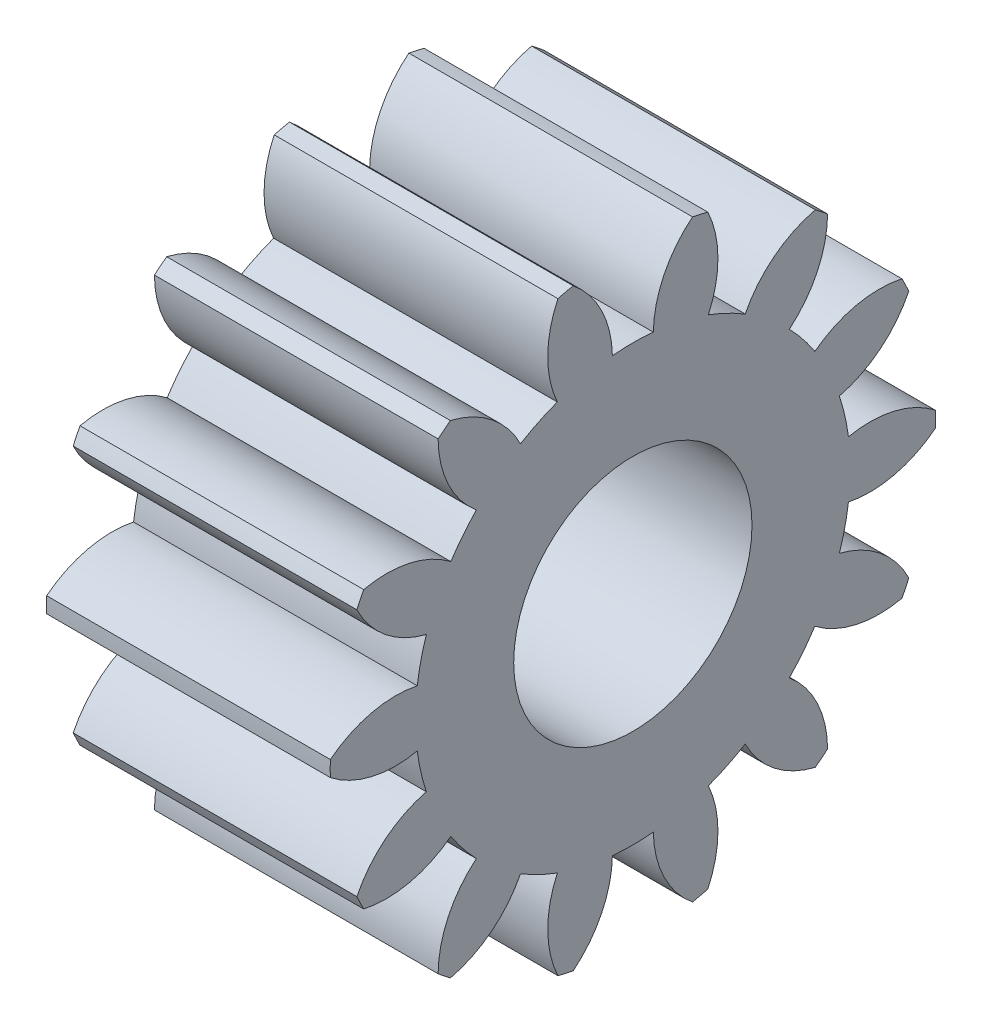
from build123d import *

# Parameters (mm, degrees)
BOSS_EXTRUDE1_START       = -4.9
BOSS_EXTRUDE1_DEPTH       = 4.9
BOSS_EXTRUDE1_START_2     = -8
BOSS_EXTRUDE1_2_OUTLINE_R = 5
BOSS_EXTRUDE1_2_DEPTH     = 3.1
SKETCH2_R                 = 5.05
CUT_EXTRUDE1_DEPTH        = 3.1
SKETCH3_R                 = 3.25
CUT_EXTRUDE2_DEPTH        = 13.227872143
SKETCH4_R                 = 4
CUT_EXTRUDE3_DEPTH        = 10
SKETCH5_R                 = 4
SKETCH5_R_2               = 3
BOSS_EXTRUDE2_DEPTH       = 4.9
BOSS_EXTRUDE3_DEPTH       = 1
BOSS_EXTRUDE3_DEPTH_BACK  = 1
FILLET1_R                 = 1
SKETCH8_R                 = 3.15
CUT_EXTRUDE4_DEPTH        = 10
BOSS_EXTRUDE4_START       = 3.1
SKETCH9_R                 = 5.05
SKETCH9_R_2               = 3.15
BOSS_EXTRUDE4_DEPTH       = 3.1
SKETCH10_R                = 9.67908905
CUT_EXTRUDE5_DEPTH        = 0.5


with BuildPart() as part:
    # Boss-Extrude1: read off the stored shape, not the designer's step
    # Boss-Extrude1 outline → Boss-Extrude1 (new body)
    with BuildSketch(Plane(origin=(8, 0, 0), x_dir=(0, 0, -1), z_dir=(1, 0, 0)).offset(BOSS_EXTRUDE1_START)):
        with BuildLine():
            ThreePointArc((-7.295176575, -3.283351754), (-7.207750943, -3.471069913), (-7.115495966, -3.656462382))
            ThreePointArc((-7.115495966, -3.656462382), (-5.907248739, -3.655787226), (-4.811777955, -3.146075955))
            ThreePointArc((-4.811777955, -3.146075955), (-4.494749193, -3.584442871), (-4.137918587, -3.991068875))
            ThreePointArc((-4.137918587, -3.991068875), (-4.878615514, -4.945652492), (-5.148134044, -6.123456202))
            ThreePointArc((-5.148134044, -6.123456202), (-4.987918415, -6.25465186), (-4.824360775, -6.381656769))
            ThreePointArc((-4.824360775, -6.381656769), (-3.736060578, -5.856809649), (-2.970230937, -4.922268702))
            ThreePointArc((-2.970230937, -4.922268702), (-2.494397616, -5.179670022), (-1.996475938, -5.391204395))
            ThreePointArc((-1.996475938, -5.391204395), (-2.249642501, -6.572630868), (-1.981440428, -7.750735051))
            ThreePointArc((-1.981440428, -7.750735051), (-1.780167471, -7.799423297), (-1.577701765, -7.842885766))
            ThreePointArc((-1.577701765, -7.842885766), (-0.824899799, -6.897819092), (-0.540393256, -5.723545765))
            ThreePointArc((-0.540393256, -5.723545765), (0, -5.749), (0.540393256, -5.723545765))
            ThreePointArc((0.540393256, -5.723545765), (0.824899799, -6.897819092), (1.577701765, -7.842885766))
            ThreePointArc((1.577701765, -7.842885766), (1.780167471, -7.799423297), (1.981440428, -7.750735051))
            ThreePointArc((1.981440428, -7.750735051), (2.249642501, -6.572630868), (1.996475938, -5.391204395))
            ThreePointArc((1.996475938, -5.391204395), (2.494397616, -5.179670022), (2.970230937, -4.922268702))
            ThreePointArc((2.970230937, -4.922268702), (3.736060578, -5.856809649), (4.824360775, -6.381656769))
            ThreePointArc((4.824360775, -6.381656769), (4.987918415, -6.25465186), (5.148134044, -6.123456202))
            ThreePointArc((5.148134044, -6.123456202), (4.878615514, -4.945652492), (4.137918587, -3.991068875))
            ThreePointArc((4.137918587, -3.991068875), (4.494749193, -3.584442871), (4.811777955, -3.146075955))
            ThreePointArc((4.811777955, -3.146075955), (5.907248739, -3.655787226), (7.115495966, -3.656462382))
            ThreePointArc((7.115495966, -3.656462382), (7.207750943, -3.471069913), (7.295176575, -3.283351754))
            ThreePointArc((7.295176575, -3.283351754), (6.541318892, -2.339126986), (5.459795711, -1.800453218))
            ThreePointArc((5.459795711, -1.800453218), (5.604860567, -1.27927285), (5.700293335, -0.746764281))
            ThreePointArc((5.700293335, -0.746764281), (6.90843384, -0.730691307), (7.997319916, -0.207060777))
            ThreePointArc((7.997319916, -0.207060777), (8, 0), (7.997319916, 0.207060777))
            ThreePointArc((7.997319916, 0.207060777), (6.90843384, 0.730691307), (5.700293335, 0.746764281))
            ThreePointArc((5.700293335, 0.746764281), (5.604860567, 1.27927285), (5.459795711, 1.800453218))
            ThreePointArc((5.459795711, 1.800453218), (6.541318892, 2.339126986), (7.295176575, 3.283351754))
            ThreePointArc((7.295176575, 3.283351754), (7.207750943, 3.471069913), (7.115495966, 3.656462382))
            ThreePointArc((7.115495966, 3.656462382), (5.907248739, 3.655787226), (4.811777955, 3.146075955))
            ThreePointArc((4.811777955, 3.146075955), (4.494749193, 3.584442871), (4.137918587, 3.991068875))
            ThreePointArc((4.137918587, 3.991068875), (4.878615514, 4.945652492), (5.148134044, 6.123456202))
            ThreePointArc((5.148134044, 6.123456202), (4.987918415, 6.25465186), (4.824360775, 6.381656769))
            ThreePointArc((4.824360775, 6.381656769), (3.736060578, 5.856809649), (2.970230937, 4.922268702))
            ThreePointArc((2.970230937, 4.922268702), (2.494397616, 5.179670022), (1.996475938, 5.391204395))
            ThreePointArc((1.996475938, 5.391204395), (2.249642501, 6.572630868), (1.981440428, 7.750735051))
            ThreePointArc((1.981440428, 7.750735051), (1.780167471, 7.799423297), (1.577701765, 7.842885766))
            ThreePointArc((1.577701765, 7.842885766), (0.824899799, 6.897819092), (0.540393256, 5.723545765))
            ThreePointArc((0.540393256, 5.723545765), (0, 5.749), (-0.540393256, 5.723545765))
            ThreePointArc((-0.540393256, 5.723545765), (-0.824899799, 6.897819092), (-1.577701765, 7.842885766))
            ThreePointArc((-1.577701765, 7.842885766), (-1.780167471, 7.799423297), (-1.981440428, 7.750735051))
            ThreePointArc((-1.981440428, 7.750735051), (-2.249642501, 6.572630868), (-1.996475938, 5.391204395))
            ThreePointArc((-1.996475938, 5.391204395), (-2.494397616, 5.179670022), (-2.970230937, 4.922268702))
            ThreePointArc((-2.970230937, 4.922268702), (-3.736060578, 5.856809649), (-4.824360775, 6.381656769))
            ThreePointArc((-4.824360775, 6.381656769), (-4.987918415, 6.25465186), (-5.148134044, 6.123456202))
            ThreePointArc((-5.148134044, 6.123456202), (-4.878615514, 4.945652492), (-4.137918587, 3.991068875))
            ThreePointArc((-4.137918587, 3.991068875), (-4.494749193, 3.584442871), (-4.811777955, 3.146075955))
            ThreePointArc((-4.811777955, 3.146075955), (-5.907248739, 3.655787226), (-7.115495966, 3.656462382))
            ThreePointArc((-7.115495966, 3.656462382), (-7.207750943, 3.471069913), (-7.295176575, 3.283351754))
            ThreePointArc((-7.295176575, 3.283351754), (-6.541318892, 2.339126986), (-5.459795711, 1.800453218))
            ThreePointArc((-5.459795711, 1.800453218), (-5.604860567, 1.27927285), (-5.700293335, 0.746764281))
            ThreePointArc((-5.700293335, 0.746764281), (-6.90843384, 0.730691307), (-7.997319916, 0.207060777))
            ThreePointArc((-7.997319916, 0.207060777), (-8, 0), (-7.997319916, -0.207060777))
            ThreePointArc((-7.997319916, -0.207060777), (-6.90843384, -0.730691307), (-5.700293335, -0.746764281))
            ThreePointArc((-5.700293335, -0.746764281), (-5.604860567, -1.27927285), (-5.459795711, -1.800453218))
            ThreePointArc((-5.459795711, -1.800453218), (-6.541318892, -2.339126986), (-7.295176575, -3.283351754))
        make_face()
    extrude(amount=BOSS_EXTRUDE1_DEPTH)

    # Boss-Extrude1 2 outline → Boss-Extrude1 2 (add)
    with BuildSketch(Plane(origin=(8, 0, 0), x_dir=(0, 0, -1), z_dir=(1, 0, 0)).offset(BOSS_EXTRUDE1_START_2)):
        with BuildLine():
            ThreePointArc((-7.295176575, -3.283351754), (-7.207750943, -3.471069913), (-7.115495966, -3.656462382))
            ThreePointArc((-7.115495966, -3.656462382), (-5.907248739, -3.655787226), (-4.811777955, -3.146075955))
            ThreePointArc((-4.811777955, -3.146075955), (-4.494749193, -3.584442871), (-4.137918587, -3.991068875))
            ThreePointArc((-4.137918587, -3.991068875), (-4.878615514, -4.945652492), (-5.148134044, -6.123456202))
            ThreePointArc((-5.148134044, -6.123456202), (-4.987918415, -6.25465186), (-4.824360775, -6.381656769))
            ThreePointArc((-4.824360775, -6.381656769), (-3.736060578, -5.856809649), (-2.970230937, -4.922268702))
            ThreePointArc((-2.970230937, -4.922268702), (-2.494397616, -5.179670022), (-1.996475938, -5.391204395))
            ThreePointArc((-1.996475938, -5.391204395), (-2.249642501, -6.572630868), (-1.981440428, -7.750735051))
            ThreePointArc((-1.981440428, -7.750735051), (-1.780167471, -7.799423297), (-1.577701765, -7.842885766))
            ThreePointArc((-1.577701765, -7.842885766), (-0.824899799, -6.897819092), (-0.540393256, -5.723545765))
            ThreePointArc((-0.540393256, -5.723545765), (0, -5.749), (0.540393256, -5.723545765))
            ThreePointArc((0.540393256, -5.723545765), (0.824899799, -6.897819092), (1.577701765, -7.842885766))
            ThreePointArc((1.577701765, -7.842885766), (1.780167471, -7.799423297), (1.981440428, -7.750735051))
            ThreePointArc((1.981440428, -7.750735051), (2.249642501, -6.572630868), (1.996475938, -5.391204395))
            ThreePointArc((1.996475938, -5.391204395), (2.494397616, -5.179670022), (2.970230937, -4.922268702))
            ThreePointArc((2.970230937, -4.922268702), (3.736060578, -5.856809649), (4.824360775, -6.381656769))
            ThreePointArc((4.824360775, -6.381656769), (4.987918415, -6.25465186), (5.148134044, -6.123456202))
            ThreePointArc((5.148134044, -6.123456202), (4.878615514, -4.945652492), (4.137918587, -3.991068875))
            ThreePointArc((4.137918587, -3.991068875), (4.494749193, -3.584442871), (4.811777955, -3.146075955))
            ThreePointArc((4.811777955, -3.146075955), (5.907248739, -3.655787226), (7.115495966, -3.656462382))
            ThreePointArc((7.115495966, -3.656462382), (7.207750943, -3.471069913), (7.295176575, -3.283351754))
            ThreePointArc((7.295176575, -3.283351754), (6.541318892, -2.339126986), (5.459795711, -1.800453218))
            ThreePointArc((5.459795711, -1.800453218), (5.604860567, -1.27927285), (5.700293335, -0.746764281))
            ThreePointArc((5.700293335, -0.746764281), (6.90843384, -0.730691307), (7.997319916, -0.207060777))
            ThreePointArc((7.997319916, -0.207060777), (8, 0), (7.997319916, 0.207060777))
            ThreePointArc((7.997319916, 0.207060777), (6.90843384, 0.730691307), (5.700293335, 0.746764281))
            ThreePointArc((5.700293335, 0.746764281), (5.604860567, 1.27927285), (5.459795711, 1.800453218))
            ThreePointArc((5.459795711, 1.800453218), (6.541318892, 2.339126986), (7.295176575, 3.283351754))
            ThreePointArc((7.295176575, 3.283351754), (7.207750943, 3.471069913), (7.115495966, 3.656462382))
            ThreePointArc((7.115495966, 3.656462382), (5.907248739, 3.655787226), (4.811777955, 3.146075955))
            ThreePointArc((4.811777955, 3.146075955), (4.494749193, 3.584442871), (4.137918587, 3.991068875))
            ThreePointArc((4.137918587, 3.991068875), (4.878615514, 4.945652492), (5.148134044, 6.123456202))
            ThreePointArc((5.148134044, 6.123456202), (4.987918415, 6.25465186), (4.824360775, 6.381656769))
            ThreePointArc((4.824360775, 6.381656769), (3.736060578, 5.856809649), (2.970230937, 4.922268702))
            ThreePointArc((2.970230937, 4.922268702), (2.494397616, 5.179670022), (1.996475938, 5.391204395))
            ThreePointArc((1.996475938, 5.391204395), (2.249642501, 6.572630868), (1.981440428, 7.750735051))
            ThreePointArc((1.981440428, 7.750735051), (1.780167471, 7.799423297), (1.577701765, 7.842885766))
            ThreePointArc((1.577701765, 7.842885766), (0.824899799, 6.897819092), (0.540393256, 5.723545765))
            ThreePointArc((0.540393256, 5.723545765), (0, 5.749), (-0.540393256, 5.723545765))
            ThreePointArc((-0.540393256, 5.723545765), (-0.824899799, 6.897819092), (-1.577701765, 7.842885766))
            ThreePointArc((-1.577701765, 7.842885766), (-1.780167471, 7.799423297), (-1.981440428, 7.750735051))
            ThreePointArc((-1.981440428, 7.750735051), (-2.249642501, 6.572630868), (-1.996475938, 5.391204395))
            ThreePointArc((-1.996475938, 5.391204395), (-2.494397616, 5.179670022), (-2.970230937, 4.922268702))
            ThreePointArc((-2.970230937, 4.922268702), (-3.736060578, 5.856809649), (-4.824360775, 6.381656769))
            ThreePointArc((-4.824360775, 6.381656769), (-4.987918415, 6.25465186), (-5.148134044, 6.123456202))
            ThreePointArc((-5.148134044, 6.123456202), (-4.878615514, 4.945652492), (-4.137918587, 3.991068875))
            ThreePointArc((-4.137918587, 3.991068875), (-4.494749193, 3.584442871), (-4.811777955, 3.146075955))
            ThreePointArc((-4.811777955, 3.146075955), (-5.907248739, 3.655787226), (-7.115495966, 3.656462382))
            ThreePointArc((-7.115495966, 3.656462382), (-7.207750943, 3.471069913), (-7.295176575, 3.283351754))
            ThreePointArc((-7.295176575, 3.283351754), (-6.541318892, 2.339126986), (-5.459795711, 1.800453218))
            ThreePointArc((-5.459795711, 1.800453218), (-5.604860567, 1.27927285), (-5.700293335, 0.746764281))
            ThreePointArc((-5.700293335, 0.746764281), (-6.90843384, 0.730691307), (-7.997319916, 0.207060777))
            ThreePointArc((-7.997319916, 0.207060777), (-8, 0), (-7.997319916, -0.207060777))
            ThreePointArc((-7.997319916, -0.207060777), (-6.90843384, -0.730691307), (-5.700293335, -0.746764281))
            ThreePointArc((-5.700293335, -0.746764281), (-5.604860567, -1.27927285), (-5.459795711, -1.800453218))
            ThreePointArc((-5.459795711, -1.800453218), (-6.541318892, -2.339126986), (-7.295176575, -3.283351754))
        make_face()
        Circle(BOSS_EXTRUDE1_2_OUTLINE_R, mode=Mode.SUBTRACT)
    extrude(amount=BOSS_EXTRUDE1_2_DEPTH)

    # Sketch2 → Cut-Extrude1 (cut)
    with BuildSketch(Plane.ZY):
        Circle(SKETCH2_R)
    extrude(amount=-CUT_EXTRUDE1_DEPTH, mode=Mode.SUBTRACT)

    # Sketch3 → Cut-Extrude2 (cut, through all)
    with BuildSketch(Plane.ZY.offset(-3.1)):
        Circle(SKETCH3_R)
    extrude(amount=-CUT_EXTRUDE2_DEPTH, mode=Mode.SUBTRACT)

    # Sketch4 → Cut-Extrude3 (cut)
    with BuildSketch(Plane(origin=(8, 0, 0), x_dir=(0, 0, -1), z_dir=(1, 0, 0))):
        Circle(SKETCH4_R)
    extrude(amount=-CUT_EXTRUDE3_DEPTH, mode=Mode.SUBTRACT)

    # Sketch5 → Boss-Extrude2 (add)
    with BuildSketch(Plane(origin=(8, 0, 0), x_dir=(0, 0, -1), z_dir=(1, 0, 0))):
        Circle(SKETCH5_R)
        Circle(SKETCH5_R_2, mode=Mode.SUBTRACT)
    extrude(amount=-BOSS_EXTRUDE2_DEPTH)

    # Sketch7 → Boss-Extrude3 (add, two sides: drawn at the far end of the back side and taken through both)
    with BuildSketch(Plane.ZY.offset(-1.6).offset(-BOSS_EXTRUDE3_DEPTH_BACK)):
        with BuildLine():
            ThreePointArc((5.096691895, -0.934506311), (5.181657101, 0), (5.096691895, 0.934506311))
            ThreePointArc((5.096691895, 0.934506311), (4.95, 0), (5.096691895, -0.934506311))
        make_face()
        with BuildLine():
            ThreePointArc((-5.096691895, -0.934506311), (-4.95, 0), (-5.096691895, 0.934506311))
            ThreePointArc((-5.096691895, 0.934506311), (-5.181657101, 0), (-5.096691895, -0.934506311))
        make_face()
    extrude(amount=BOSS_EXTRUDE3_DEPTH + BOSS_EXTRUDE3_DEPTH_BACK)

    # Fillet1
    # the kernel refuses this fillet: 1 mm, written as the material it takes off along each edge
    with BuildSketch(Plane(origin=(0.6, 0, 8), x_dir=(0, 0.853406197512974, -0.5212464503921795), z_dir=(0, 0.5212464503921795, 0.853406197512974))) as fillet1_piece_1_section:
        with BuildLine():
            CenterArc((3.05 - FILLET1_R, -FILLET1_R), FILLET1_R, 0, 90)
            Line((3.05, -FILLET1_R), (3.05, 0))
            Line((3.05, 0), (3.05 - FILLET1_R, 0))
        make_face()
    fillet1_piece_1 = revolve(axis=Axis((0.6, 0, 8), (-1, 0, 0)), revolution_arc=117.16820376, mode=Mode.PRIVATE)
    fillet1_piece_1 = fillet1_piece_1 & Plane(origin=(0.6, 0, 0), x_dir=(0, 0, 1), z_dir=(-1, 0, 0)) * Cylinder(5.05, 13, mode=Mode.PRIVATE)
    add(fillet1_piece_1, mode=Mode.SUBTRACT)
    with BuildSketch(Plane(origin=(0.6, 0, -8), x_dir=(0, -0.8534061975130341, 0.521246450392081), z_dir=(0, -0.521246450392081, -0.8534061975130341))) as fillet1_piece_2_section:
        with BuildLine():
            CenterArc((3.05 - FILLET1_R, -FILLET1_R), FILLET1_R, 0, 90)
            Line((3.05 - FILLET1_R, 0), (3.05, 0))
            Line((3.05, 0), (3.05, -FILLET1_R))
        make_face()
    fillet1_piece_2 = revolve(axis=Axis((0.6, 0, -8), (-1, 0, 0)), revolution_arc=117.16820376, mode=Mode.PRIVATE)
    fillet1_piece_2 = fillet1_piece_2 & Plane(origin=(0.6, 0, 0), x_dir=(0, 0, 1), z_dir=(-1, 0, 0)) * Cylinder(5.05, 13, mode=Mode.PRIVATE)
    add(fillet1_piece_2, mode=Mode.SUBTRACT)
    with BuildSketch(Plane(origin=(2.6, 0, -8), x_dir=(0, -0.8534061975130341, 0.521246450392081), z_dir=(0, -0.521246450392081, -0.8534061975130341))) as fillet1_piece_3_section:
        with BuildLine():
            CenterArc((3.05 - FILLET1_R, FILLET1_R), FILLET1_R, 270, 90)
            Line((3.05 - FILLET1_R, 0), (3.05, 0))
            Line((3.05, 0), (3.05, FILLET1_R))
        make_face()
    fillet1_piece_3 = revolve(axis=Axis((2.6, 0, -8), (-1, 0, 0)), revolution_arc=117.16820376, mode=Mode.PRIVATE)
    fillet1_piece_3 = fillet1_piece_3 & Plane(origin=(2.6, 0, 0), x_dir=(0, 0, 1), z_dir=(-1, 0, 0)) * Cylinder(5.05, 13, mode=Mode.PRIVATE)
    add(fillet1_piece_3, mode=Mode.SUBTRACT)
    with BuildSketch(Plane(origin=(2.6, 0, 8), x_dir=(0, 0.853406197512974, -0.5212464503921795), z_dir=(0, 0.5212464503921795, 0.853406197512974))) as fillet1_piece_4_section:
        with BuildLine():
            CenterArc((3.05 - FILLET1_R, FILLET1_R), FILLET1_R, 270, 90)
            Line((3.05 - FILLET1_R, 0), (3.05, 0))
            Line((3.05, 0), (3.05, FILLET1_R))
        make_face()
    fillet1_piece_4 = revolve(axis=Axis((2.6, 0, 8), (-1, 0, 0)), revolution_arc=117.16820376, mode=Mode.PRIVATE)
    fillet1_piece_4 = fillet1_piece_4 & Plane(origin=(2.6, 0, 0), x_dir=(0, 0, 1), z_dir=(-1, 0, 0)) * Cylinder(5.05, 13, mode=Mode.PRIVATE)
    add(fillet1_piece_4, mode=Mode.SUBTRACT)

    # Sketch8 → Cut-Extrude4 (cut)
    with BuildSketch(Plane.ZY.offset(-3.1)):
        Circle(SKETCH8_R)
    extrude(amount=-CUT_EXTRUDE4_DEPTH, mode=Mode.SUBTRACT)

    # Sketch9 → Boss-Extrude4 (add)
    with BuildSketch(Plane.ZY.offset(-3.1).offset(BOSS_EXTRUDE4_START)):
        Circle(SKETCH9_R)
        Circle(SKETCH9_R_2, mode=Mode.SUBTRACT)
    extrude(amount=-BOSS_EXTRUDE4_DEPTH)

    # Sketch10 → Cut-Extrude5 (cut)
    with BuildSketch(Plane.ZY):
        Circle(SKETCH10_R)
    extrude(amount=-CUT_EXTRUDE5_DEPTH, mode=Mode.SUBTRACT)


solid = part.part
